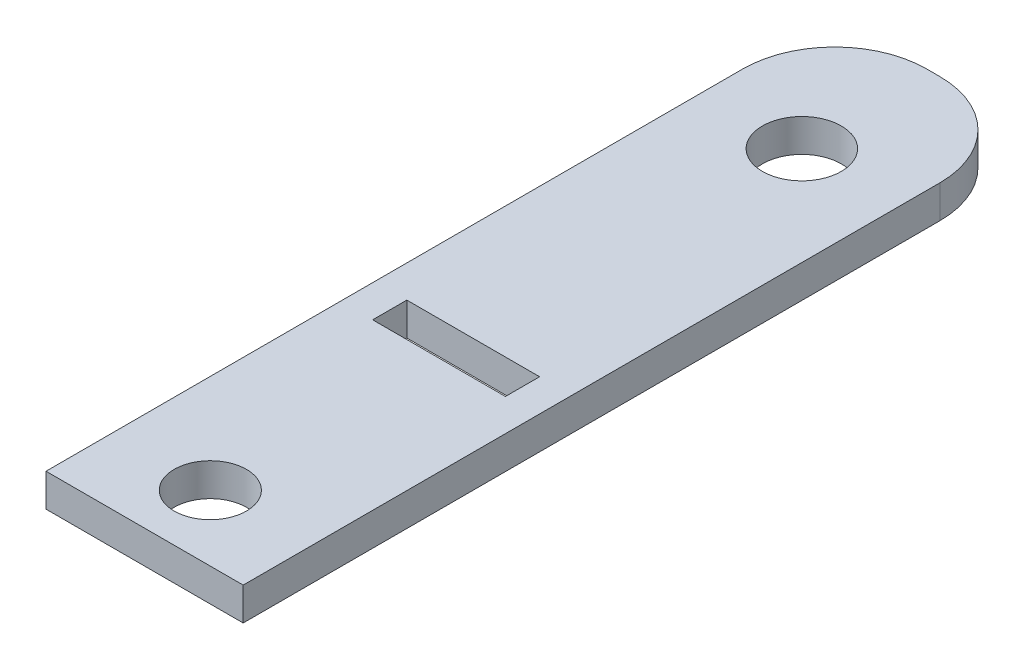
from build123d import *

# Parameters (mm, degrees)
STEM_START                = -3.244746183
STEM_OTHER_SIDE_OUTLINE_W = 12.827
STEM_OTHER_SIDE_OUTLINE_H = 3.302
STEM_OTHER_SIDE_OUTLINE_R = 3.81
STEM_OTHER_SIDE_DEPTH     = 3.175
SKETCH1_R                 = 3.4925
CUT_EXTRUDE1_DEPTH        = 3.175


# Read off the part's stored shape, not the designer's step: Stem Other Side
with BuildPart() as part:
    # Stem Other Side outline → Stem Other Side (new body)
    with BuildSketch(Plane(origin=(0, 0, 0), x_dir=(1, 0, 0), z_dir=(0, 1, 0)).offset(STEM_START)):
        with BuildLine():
            Line((-4.25309824, 33.316184511), (-5.52309824, 33.316184511))
            ThreePointArc((-5.52309824, 33.316184511), (-11.809277525, 30.712363796), (-14.41309824, 24.426184511))
            Line((-14.41309824, 24.426184511), (-14.41309824, -42.883815489))
            Line((-14.41309824, -42.883815489), (4.63690176, -42.883815489))
            Line((4.63690176, -42.883815489), (4.63690176, 24.426184511))
            ThreePointArc((4.63690176, 24.426184511), (2.033081045, 30.712363796), (-4.25309824, 33.316184511))
        make_face()
        with Locations((-4.88809824, -12.784815489)):
            Rectangle(STEM_OTHER_SIDE_OUTLINE_W, STEM_OTHER_SIDE_OUTLINE_H, mode=Mode.SUBTRACT)
        with Locations((-4.88809824, 20.616184511)):
            Circle(STEM_OTHER_SIDE_OUTLINE_R, mode=Mode.SUBTRACT)
    extrude(amount=STEM_OTHER_SIDE_DEPTH)

    # Sketch1 → Cut-Extrude1 (cut)
    with BuildSketch(Plane(origin=(0, -0.069746183, 0), x_dir=(1, 0, 0), z_dir=(0, 1, 0))):
        with Locations(Location((-4.88809824, -36.533815489, 0), (0, 0, 270))):
            Circle(SKETCH1_R)
    extrude(amount=-CUT_EXTRUDE1_DEPTH, mode=Mode.SUBTRACT)


solid = part.part
